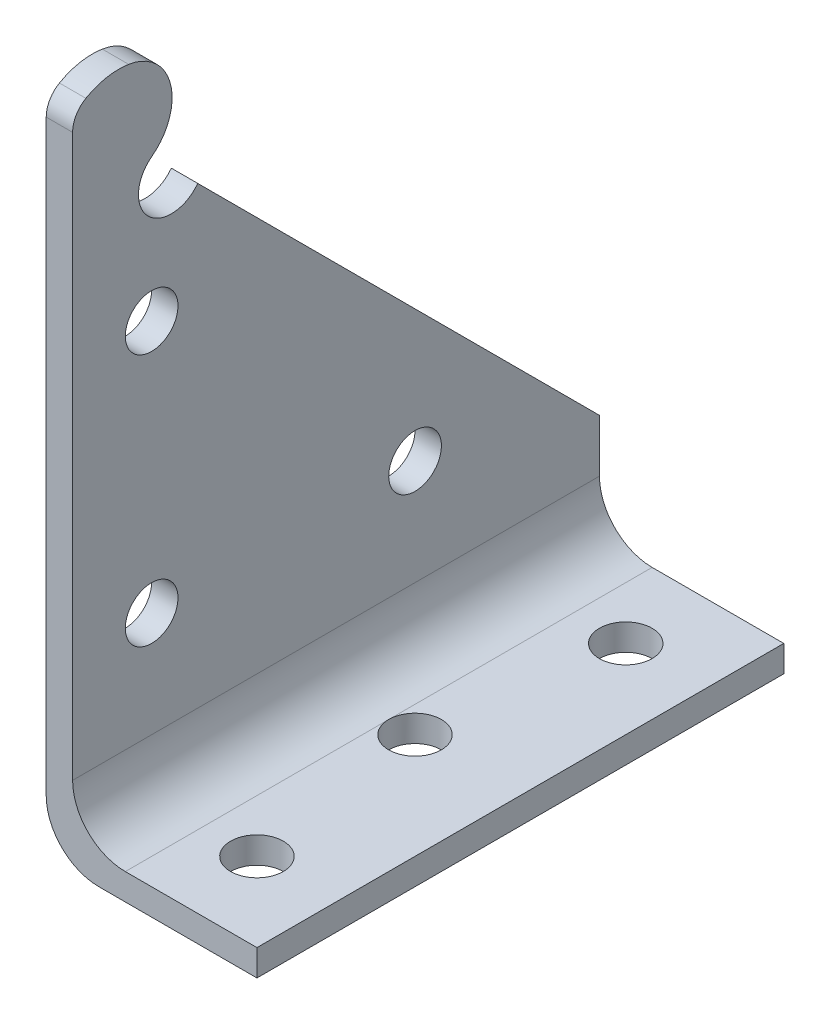
from build123d import *
from OCP.BRepAlgoAPI import BRepAlgoAPI_Cut
from OCP.TopTools import TopTools_ListOfShape

# Parameters (mm, degrees)
BOSS_EXTRUDE1_DEPTH = 31.75
FILLET1_R           = 6.35
FILLET2_R           = 6.35
SKETCH2_R           = 3.175
CUT_EXTRUDE1_DEPTH  = 91.045060242
SKETCH3_R           = 3.175
CUT_EXTRUDE2_DEPTH  = 88.78435863


with BuildPart() as part:
    # Sketch1 → Boss-Extrude1 (new, symmetric)
    with BuildSketch(Plane.XY):
        Polygon((0, 0), (0, 81.28), (3.18262, 81.28), (3.18262, 3.175), (25.4, 3.175), (25.4, 0), align=None)
    extrude(amount=BOSS_EXTRUDE1_DEPTH, both=True)

    # Fillet1
    fillet1_edges = [part.edges().sort_by_distance(p)[0] for p in [
        (0, 0, 0),
    ]]
    fillet(fillet1_edges, radius=FILLET1_R)

    # Fillet2
    fillet2_edges = [part.edges().sort_by_distance(p)[0] for p in [
        (3.18262, 3.175, 0),
    ]]
    fillet(fillet2_edges, radius=FILLET2_R)

    # Sketch2 → Cut-Extrude1 (cut, through all)
    with BuildSketch(Plane(origin=(3.18262, 0, 0), x_dir=(0, 0, -1), z_dir=(1, 0, 0))):
        with BuildLine():
            Line((-16.669475788, 64.294475788), (31.75, 15.875))
            Line((31.75, 15.875), (31.75, 81.28))
            Line((31.75, 81.28), (-31.75, 81.28))
            Line((-31.75, 81.28), (-31.75, 77.162449779))
            ThreePointArc((-31.75, 77.162449779), (-31.322215929, 78.755231969), (-30.153989397, 79.919363013))
            ThreePointArc((-30.153989397, 79.919363013), (-27.655141351, 80.839968054), (-24.992465889, 80.883724047))
            ThreePointArc((-24.992465889, 80.883724047), (-19.942292543, 76.286679217), (-22.225544212, 69.850544212))
            ThreePointArc((-22.225544212, 69.850544212), (-22.651350038, 63.868669962), (-16.669475788, 64.294475788))
        make_face()
        with Locations((-22.225, 22.225)):
            Circle(SKETCH2_R)
        with Locations((9.525, 22.225)):
            Circle(SKETCH2_R)
        with Locations((-22.225, 52.705)):
            Circle(SKETCH2_R)
    extrude(amount=-CUT_EXTRUDE1_DEPTH, mode=Mode.SUBTRACT)


with BuildPart() as cut_extrude2_tool:
    # Sketch3 → Cut-Extrude2 (new, through all)
    with BuildSketch(Plane(origin=(0, 3.175, 0), x_dir=(1, 0, 0), z_dir=(0, 1, 0))):
        with Locations((15.875, -22.225)):
            Circle(SKETCH3_R)
        with Locations((12.7, 0)):
            Circle(SKETCH3_R)
        with Locations((15.875, 22.225)):
            Circle(SKETCH3_R)
    extrude(amount=-CUT_EXTRUDE2_DEPTH)


with BuildPart() as part_1:
    add(part.part)

    # Cut-Extrude2: cut by cut_extrude2_tool, with a tolerance
    cut_extrude2_stock = TopTools_ListOfShape()
    cut_extrude2_stock.Append(part_1.part.wrapped)
    cut_extrude2_tools = TopTools_ListOfShape()
    cut_extrude2_tools.Append(cut_extrude2_tool.part.wrapped)
    cut_extrude2_cut = BRepAlgoAPI_Cut()
    cut_extrude2_cut.SetArguments(cut_extrude2_stock)
    cut_extrude2_cut.SetTools(cut_extrude2_tools)
    cut_extrude2_cut.SetFuzzyValue(0.00001)
    cut_extrude2_cut.Build()
    add(Compound.cast(cut_extrude2_cut.Shape()).solids(), mode=Mode.REPLACE)


solid = part_1.part
